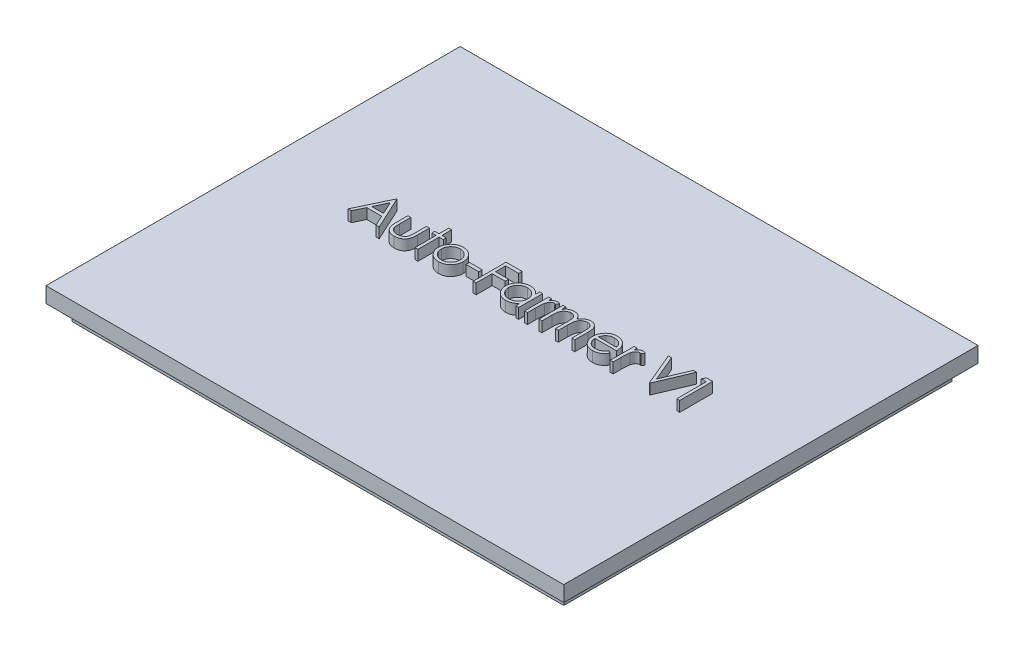
from build123d import *

# Parameters (mm, degrees)
SKETCH1_W           = 100
SKETCH1_H           = 80
BOSS_EXTRUDE1_DEPTH = 3
SKETCH2_W           = 95
SKETCH2_H           = 75
BOSS_EXTRUDE2_DEPTH = 3
SKETCH3_W           = 2.442307692
SKETCH3_H           = 0.651282051
BOSS_EXTRUDE3_DEPTH = 2


with BuildPart() as part:
    # Sketch1 → Boss-Extrude1 (new body)
    with BuildSketch(Plane(origin=(0, 0, 0), x_dir=(1, 0, 0), z_dir=(0, 1, 0))):
        Rectangle(SKETCH1_W, SKETCH1_H)
    extrude(amount=BOSS_EXTRUDE1_DEPTH)

    # Sketch2 → Boss-Extrude2 (add)
    with BuildSketch(Plane.XZ):
        Rectangle(SKETCH2_W, SKETCH2_H)
    extrude(amount=BOSS_EXTRUDE2_DEPTH)

    # Sketch3 → Boss-Extrude3 (add)
    # profile 1 of 13: a face of its own
    with BuildSketch(Plane(origin=(0, 3, 0), x_dir=(1, 0, 0), z_dir=(0, 1, 0))):
        Polygon((-28.580769231, 6.35), (-25.65, 0), (-26.26948117, 0), (-27.208243189, 2.03525641), (-30.086858974, 2.03525641), (-31.052333734, 0), (-31.674358974, 0), (-28.662179487, 6.35), align=None)
        Polygon((-28.627834535, 5.112309696), (-29.777754407, 2.686538462), (-27.50844351, 2.686538462), align=None, mode=Mode.SUBTRACT)
    # profile 2 of 13: a face of its own
    with BuildSketch(Plane(origin=(0, 3, 0), x_dir=(1, 0, 0), z_dir=(0, 1, 0))):
        with BuildLine():
            Line((-24.754487179, 4.640384615), (-24.184615385, 4.640384615))
            Line((-24.184615385, 4.640384615), (-24.184615385, 2.488100962))
            add(Edge.make_bspline(
                [(-24.184615385, 2.488100962), (-24.184357929, 2.424922545), (-24.183865427, 2.304065194), (-24.180525434, 2.130156498), (-24.172669407, 1.971557605), (-24.162847183, 1.828176897), (-24.150215879, 1.700038629), (-24.135187496, 1.587590367), (-24.118390074, 1.489556919), (-24.101947722, 1.430513974), (-24.094300881, 1.403054888)],
                knots=[0, 0, 0, 0, 1.388932606, 2.656963016, 3.823490214, 4.879454478, 5.816252168, 6.653371382, 7.373723809, 8, 8, 8, 8], degree=3))
            add(Edge.make_bspline(
                [(-24.094300881, 1.403054888), (-24.08203367, 1.368541965), (-24.05775428, 1.300233634), (-24.013715245, 1.201556439), (-23.959235263, 1.110161284), (-23.899618147, 1.022523894), (-23.830857793, 0.94124029), (-23.753824181, 0.866447733), (-23.671095951, 0.795320311), (-23.54816898, 0.711165045), (-23.380058598, 0.620967232), (-23.159345742, 0.543141961), (-22.920033789, 0.496631259), (-22.754634941, 0.491235111), (-22.669621394, 0.488461538)],
                knots=[0, 0, 0, 0, 0.725840625, 1.436591201, 2.137033971, 2.831655856, 3.53531722, 4.242432219, 4.957935707, 5.694543706, 7.190802206, 8.724350549, 10.316345118, 12, 12, 12, 12], degree=3))
            add(Edge.make_bspline(
                [(-22.669621394, 0.488461538), (-22.584615745, 0.491294089), (-22.420145541, 0.496774552), (-22.183462953, 0.541738972), (-21.967106816, 0.616860722), (-21.773248661, 0.721739883), (-21.60276778, 0.850086197), (-21.460701192, 1.000687893), (-21.343485173, 1.168780352), (-21.292305224, 1.294191544), (-21.266566506, 1.357261619)],
                knots=[0, 0, 0, 0, 1.157059328, 2.238695713, 3.266970494, 4.264342957, 5.228770407, 6.160125903, 7.074715775, 8, 8, 8, 8], degree=3))
            add(Edge.make_bspline(
                [(-21.266566506, 1.357261619), (-21.258956975, 1.382600475), (-21.242134159, 1.438618497), (-21.224059607, 1.533650326), (-21.207777369, 1.646978966), (-21.193874178, 1.779346002), (-21.183958812, 1.930405521), (-21.178613878, 2.100110317), (-21.172575435, 2.287927642), (-21.172483785, 2.419404862), (-21.172435897, 2.488100962)],
                knots=[0, 0, 0, 0, 0.557542046, 1.232589297, 2.036731608, 2.971723315, 4.038036528, 5.22795436, 6.551621927, 8, 8, 8, 8], degree=3))
            Line((-21.172435897, 2.488100962), (-21.172435897, 4.640384615))
            Line((-21.172435897, 4.640384615), (-20.602564103, 4.640384615))
            Line((-20.602564103, 4.640384615), (-20.602564103, 2.38125))
            add(Edge.make_bspline(
                [(-20.602564103, 2.38125), (-20.603365463, 2.304492703), (-20.604920212, 2.155573048), (-20.614912107, 1.939157588), (-20.632056404, 1.737477515), (-20.658078133, 1.550426074), (-20.688677285, 1.378146071), (-20.72814938, 1.220416705), (-20.775281326, 1.077723943), (-20.828449903, 0.947563862), (-20.891263863, 0.829550211), (-20.9580786, 0.717543801), (-21.035230686, 0.614323761), (-21.116456683, 0.514751884), (-21.206811115, 0.423780827), (-21.304600859, 0.339323149), (-21.408449521, 0.260087792), (-21.520661638, 0.189165042), (-21.639599066, 0.125271985), (-21.765408635, 0.068637101), (-21.899631303, 0.023819568), (-22.04053533, -0.014844068), (-22.188811059, -0.045168891), (-22.344315543, -0.066553091), (-22.506996404, -0.079661905), (-22.617866424, -0.080817687), (-22.674709535, -0.081410256)],
                knots=[0, 0, 0, 0, 1.493040784, 2.896703357, 4.213163133, 5.428574705, 6.569057535, 7.615249723, 8.588095153, 9.490268104, 10.346124644, 11.18633936, 12.024365274, 12.850166724, 13.684164916, 14.514361689, 15.362232829, 16.222528818, 17.093394965, 17.986930858, 18.902426812, 19.842810585, 20.827885679, 21.843828298, 22.894529745, 24, 24, 24, 24], degree=3))
            add(Edge.make_bspline(
                [(-22.674709535, -0.081410256), (-22.731127497, -0.080793931), (-22.841994043, -0.079582793), (-23.0046833, -0.066625513), (-23.160618629, -0.045202118), (-23.309245637, -0.014621938), (-23.450713472, 0.023548946), (-23.585595165, 0.068912503), (-23.712311343, 0.125301377), (-23.832384408, 0.18876066), (-23.944874455, 0.260543374), (-24.050300018, 0.339225389), (-24.148519736, 0.424689246), (-24.239555274, 0.516578023), (-24.322128817, 0.616031607), (-24.39726935, 0.722249981), (-24.466133658, 0.834180685), (-24.528459435, 0.954038136), (-24.582002191, 1.085704497), (-24.629273852, 1.231386373), (-24.667937438, 1.392680939), (-24.699401631, 1.569450295), (-24.72471353, 1.760848442), (-24.74228696, 1.967982567), (-24.752112824, 2.190348123), (-24.753678664, 2.343927209), (-24.754487179, 2.423227163)],
                knots=[0, 0, 0, 0, 1.083640291, 2.129454052, 3.13281866, 4.105697902, 5.042300162, 5.946461698, 6.836384745, 7.703652036, 8.553297018, 9.397182691, 10.228592656, 11.052265423, 11.879314572, 12.708807002, 13.549817954, 14.402308542, 15.300838682, 16.27712199, 17.341985831, 18.484375296, 19.725102775, 21.0496083, 22.476576903, 24, 24, 24, 24], degree=3))
            Line((-24.754487179, 2.423227163), (-24.754487179, 4.640384615))
        make_face()
    # profile 3 of 13: a face of its own
    with BuildSketch(Plane(origin=(0, 3, 0), x_dir=(1, 0, 0), z_dir=(0, 1, 0))):
        Polygon((-18.730128205, 6.512820513), (-18.16025641, 6.512820513), (-18.16025641, 4.640384615), (-17.346153846, 4.640384615), (-17.346153846, 4.070512821), (-18.16025641, 4.070512821), (-18.16025641, 0), (-18.730128205, 0), (-18.730128205, 4.070512821), (-19.544230769, 4.070512821), (-19.544230769, 4.640384615), (-18.730128205, 4.640384615), align=None)
    # profile 4 of 13: a face of its own
    with BuildSketch(Plane(origin=(0, 3, 0), x_dir=(1, 0, 0), z_dir=(0, 1, 0))):
        with BuildLine():
            add(Edge.make_bspline(
                [(-14.127904647, 4.721794872), (-14.040834767, 4.719940869), (-13.870112009, 4.716305624), (-13.620089131, 4.677452757), (-13.38142867, 4.618039682), (-13.153216578, 4.535904134), (-12.938375585, 4.425809738), (-12.733776328, 4.294438595), (-12.539979755, 4.138804461), (-12.423823687, 4.018411966), (-12.364863782, 3.957301683)],
                knots=[0, 0, 0, 0, 1.054011418, 2.066658804, 3.057071809, 4.030435133, 4.997543892, 5.974964718, 6.972108034, 8, 8, 8, 8], degree=3))
            add(Edge.make_bspline(
                [(-12.364863782, 3.957301683), (-12.314096523, 3.898856308), (-12.21354449, 3.783096639), (-12.084610971, 3.595398598), (-11.973537569, 3.401015844), (-11.88452334, 3.197367123), (-11.814337654, 2.98623022), (-11.764507034, 2.766879428), (-11.734867166, 2.53979917), (-11.730870355, 2.385577921), (-11.728846154, 2.307471955)],
                knots=[0, 0, 0, 0, 1.025258237, 2.030674902, 3.01204498, 3.988269485, 4.97094183, 5.956517959, 6.965070386, 8, 8, 8, 8], degree=3))
            add(Edge.make_bspline(
                [(-11.728846154, 2.307471955), (-11.73062658, 2.228913279), (-11.734144785, 2.073677671), (-11.767425347, 1.845042536), (-11.819188888, 1.623346215), (-11.893269509, 1.409516871), (-11.988262079, 1.202900884), (-12.10417804, 1.004400702), (-12.241830831, 0.813624688), (-12.397866654, 0.632192782), (-12.570317915, 0.464976935), (-12.75740007, 0.319238503), (-12.955436674, 0.194376595), (-13.167061043, 0.093799098), (-13.390340627, 0.014497213), (-13.625757022, -0.041201388), (-13.872944506, -0.074877586), (-14.041722465, -0.079202069), (-14.127904647, -0.081410256)],
                knots=[0, 0, 0, 0, 0.998656419, 1.973391657, 2.932242238, 3.890759089, 4.846373663, 5.82037756, 6.809684879, 7.83454468, 8.860553229, 9.859544525, 10.845671541, 11.83227036, 12.833544569, 13.85385346, 14.904124723, 16, 16, 16, 16], degree=3))
            add(Edge.make_bspline(
                [(-14.127904647, -0.081410256), (-14.214509067, -0.079194658), (-14.384128198, -0.074855295), (-14.632188194, -0.041332225), (-14.868026503, 0.014471543), (-15.091598389, 0.094059709), (-15.304132611, 0.194379809), (-15.503316684, 0.318861018), (-15.690550816, 0.465020156), (-15.86303856, 0.632181071), (-16.019064601, 0.813627706), (-16.156719916, 1.004399919), (-16.272635222, 1.202901088), (-16.367627963, 1.409516816), (-16.441708538, 1.62334623), (-16.493472092, 1.845042532), (-16.52675265, 2.073677672), (-16.530270856, 2.228913279), (-16.532051282, 2.307471955)],
                knots=[0, 0, 0, 0, 1.099876186, 2.154163076, 3.173186993, 4.173200201, 5.163417411, 6.152872554, 7.150605724, 8.17532212, 9.198891216, 10.186952605, 11.159729845, 12.11414092, 13.071450619, 14.029093627, 15.002601286, 16, 16, 16, 16], degree=3))
            add(Edge.make_bspline(
                [(-16.532051282, 2.307471955), (-16.530013276, 2.385153403), (-16.525978375, 2.538949318), (-16.496368308, 2.7656027), (-16.44673207, 2.984582249), (-16.376462251, 3.194904184), (-16.286627547, 3.397660475), (-16.177114925, 3.592523525), (-16.046866206, 3.77937282), (-15.946714094, 3.89498288), (-15.896033654, 3.953485577)],
                knots=[0, 0, 0, 0, 1.031353054, 2.041901799, 3.029428768, 4.008703097, 4.981709435, 5.96992636, 6.972712378, 8, 8, 8, 8], degree=3))
            add(Edge.make_bspline(
                [(-15.896033654, 3.953485577), (-15.837162639, 4.015125824), (-15.721382429, 4.136352216), (-15.526621165, 4.291532652), (-15.322525233, 4.425637529), (-15.10531001, 4.533544377), (-14.877285396, 4.618522831), (-14.637401913, 4.677605979), (-14.386530621, 4.716165638), (-14.214972451, 4.71989976), (-14.127904647, 4.721794872)],
                knots=[0, 0, 0, 0, 1.027980169, 2.021703884, 2.998553061, 3.971491411, 4.943284454, 5.930300938, 6.949603206, 8, 8, 8, 8], degree=3))
        make_face()
        with BuildLine():
            add(Edge.make_bspline(
                [(-14.130448718, 4.151923077), (-14.192021241, 4.150173032), (-14.313576803, 4.146718119), (-14.492500907, 4.120440178), (-14.664749472, 4.078806849), (-14.830649289, 4.019653776), (-14.989640902, 3.943274345), (-15.141876532, 3.849460606), (-15.287803959, 3.739455099), (-15.424568559, 3.613429966), (-15.55008504, 3.47576379), (-15.659809369, 3.329081768), (-15.753109205, 3.175763111), (-15.830833493, 3.015648385), (-15.888722249, 2.847115005), (-15.930764732, 2.672071574), (-15.957017883, 2.490161462), (-15.960440313, 2.3664979), (-15.962179487, 2.303655849)],
                knots=[0, 0, 0, 0, 1.021534396, 2.016698045, 2.994645724, 3.958388632, 4.93408049, 5.916473867, 6.921342795, 7.962252576, 8.998418191, 10.008913653, 10.997312074, 11.973003931, 12.956656626, 13.948281152, 14.957379055, 16, 16, 16, 16], degree=3))
            add(Edge.make_bspline(
                [(-15.962179487, 2.303655849), (-15.95926425, 2.222462886), (-15.953478049, 2.061310036), (-15.90642412, 1.823981285), (-15.827709013, 1.596139924), (-15.721414948, 1.379121624), (-15.588235094, 1.178330491), (-15.431322845, 0.999312227), (-15.252362245, 0.844760826), (-15.053486595, 0.716525577), (-14.838758047, 0.614635735), (-14.611507293, 0.542429022), (-14.374487748, 0.49549038), (-14.212506993, 0.490824991), (-14.130448718, 0.488461538)],
                knots=[0, 0, 0, 0, 1.016792936, 2.018143844, 3.017858371, 4.030088057, 5.03801393, 6.028138512, 7.003788237, 7.991172063, 8.984598303, 9.972568034, 10.972917682, 12, 12, 12, 12], degree=3))
            add(Edge.make_bspline(
                [(-14.130448718, 0.488461538), (-14.048395163, 0.490838761), (-13.886423724, 0.495531333), (-13.649733504, 0.54219262), (-13.423103869, 0.614952119), (-13.208598352, 0.716410985), (-13.009813228, 0.845247795), (-12.829565537, 0.998439508), (-12.673993056, 1.178804638), (-12.540944945, 1.379387583), (-12.43291014, 1.595803479), (-12.354563474, 1.824023336), (-12.307396425, 2.061299326), (-12.301625493, 2.222459298), (-12.298717949, 2.303655849)],
                knots=[0, 0, 0, 0, 1.02726834, 2.027799167, 3.010890988, 4.004497153, 4.992059811, 5.971914811, 6.958719428, 7.966827853, 8.981595046, 9.981490638, 10.983022906, 12, 12, 12, 12], degree=3))
            add(Edge.make_bspline(
                [(-12.298717949, 2.303655849), (-12.300456524, 2.366498275), (-12.303877776, 2.490162576), (-12.330139497, 2.672067314), (-12.372150262, 2.847130639), (-12.43015591, 3.015590702), (-12.507542478, 3.176177674), (-12.602641517, 3.328631607), (-12.711917806, 3.476271912), (-12.838948868, 3.612984946), (-12.975570711, 3.739504227), (-13.12155728, 3.849503262), (-13.27356717, 3.942862043), (-13.432096884, 4.020307079), (-13.598017971, 4.078268682), (-13.770025191, 4.120680571), (-13.948185889, 4.14660707), (-14.069305868, 4.150139741), (-14.130448718, 4.151923077)],
                knots=[0, 0, 0, 0, 1.042956736, 2.052379634, 3.044323526, 4.02829302, 5.004299113, 5.996692471, 7.007513377, 8.048758398, 9.090003419, 10.095195979, 11.07790575, 12.047570684, 13.018257071, 13.989683339, 14.985167495, 16, 16, 16, 16], degree=3))
        make_face(mode=Mode.SUBTRACT)
    # profile 5 of 13: a face of its own
    with BuildSketch(Plane(origin=(0, 3, 0), x_dir=(1, 0, 0), z_dir=(0, 1, 0))):
        with Locations((-9.775, 2.442307693)):
            Rectangle(SKETCH3_W, SKETCH3_H)
    # profile 6 of 13: a face of its own
    with BuildSketch(Plane(origin=(0, 3, 0), x_dir=(1, 0, 0), z_dir=(0, 1, 0))):
        Polygon((-7.495512821, 6.35), (-4.401923077, 6.35), (-4.401923077, 5.698717949), (-6.925641026, 5.698717949), (-6.925641026, 3.744871795), (-4.401923077, 3.744871795), (-4.401923077, 3.093589744), (-6.925641026, 3.093589744), (-6.925641026, 0), (-7.495512821, 0), align=None)
    # profile 7 of 13: a face of its own
    with BuildSketch(Plane(origin=(0, 3, 0), x_dir=(1, 0, 0), z_dir=(0, 1, 0))):
        with BuildLine():
            Line((1.296794872, 4.640384615), (1.296794872, 0))
            Line((1.296794872, 0), (0.726923077, 0))
            Line((0.726923077, 0), (0.726923077, 0.802654247))
            add(Edge.make_bspline(
                [(0.726923077, 0.802654247), (0.662663271, 0.730010983), (0.537259452, 0.588246742), (0.327816281, 0.403040514), (0.105805444, 0.249954131), (-0.127695525, 0.126310713), (-0.372475766, 0.033433696), (-0.627992667, -0.032581193), (-0.894350458, -0.075024294), (-1.076236873, -0.079262505), (-1.168409455, -0.081410256)],
                knots=[0, 0, 0, 0, 1.074387032, 2.096679803, 3.090159297, 4.057316773, 5.018401886, 5.985159533, 6.978961417, 8, 8, 8, 8], degree=3))
            add(Edge.make_bspline(
                [(-1.168409455, -0.081410256), (-1.250357029, -0.079185267), (-1.411961272, -0.074797489), (-1.649685454, -0.040757309), (-1.878452821, 0.013908247), (-2.098479546, 0.089928433), (-2.308341867, 0.190767923), (-2.509836614, 0.311492759), (-2.701919927, 0.455258265), (-2.881664004, 0.619610831), (-3.047184919, 0.79812745), (-3.192438942, 0.988528657), (-3.313548102, 1.189991122), (-3.414821677, 1.39996413), (-3.49282933, 1.620064056), (-3.547210067, 1.849529775), (-3.581210591, 2.088089974), (-3.585596556, 2.250540251), (-3.587820513, 2.33291266)],
                knots=[0, 0, 0, 0, 1.033919861, 2.038935746, 3.024066025, 3.998881131, 4.97069526, 5.957263378, 6.95902576, 7.993208707, 9.027059324, 10.027763471, 11.009749337, 11.988697705, 12.965288445, 13.950418724, 14.960734635, 16, 16, 16, 16], degree=3))
            add(Edge.make_bspline(
                [(-3.587820513, 2.33291266), (-3.585547265, 2.413582522), (-3.581053176, 2.573062488), (-3.547573763, 2.807610983), (-3.491274647, 3.033522685), (-3.412266409, 3.250070282), (-3.310953148, 3.457515801), (-3.18771219, 3.656005961), (-3.042534635, 3.846087582), (-2.875162411, 4.023291094), (-2.693852185, 4.186977065), (-2.499889202, 4.329233476), (-2.298098392, 4.452091188), (-2.085349787, 4.549433923), (-1.864792325, 4.628190441), (-1.634462502, 4.682678826), (-1.395318638, 4.714786824), (-1.232957317, 4.71943641), (-1.150600962, 4.721794872)],
                knots=[0, 0, 0, 0, 1.020392517, 2.01726096, 2.990465484, 3.961182959, 4.928053699, 5.906110375, 6.912531644, 7.948652711, 8.985773172, 9.998621852, 10.987621588, 11.969261332, 12.953316658, 13.946091881, 14.958173133, 16, 16, 16, 16], degree=3))
            add(Edge.make_bspline(
                [(-1.150600962, 4.721794872), (-1.055895503, 4.71918638), (-0.870182568, 4.71407125), (-0.59853318, 4.671503159), (-0.341549627, 4.599587654), (-0.09724816, 4.501765908), (0.133493942, 4.371774642), (0.348492213, 4.20779957), (0.549996733, 4.010874845), (0.666800976, 3.859617039), (0.726923077, 3.781760817)],
                knots=[0, 0, 0, 0, 1.038897134, 2.037228247, 3.008116434, 3.962042015, 4.918381754, 5.904844433, 6.921570401, 8, 8, 8, 8], degree=3))
            Line((0.726923077, 3.781760817), (0.726923077, 4.640384615))
            Line((0.726923077, 4.640384615), (1.296794872, 4.640384615))
        make_face()
        with BuildLine():
            add(Edge.make_bspline(
                [(-1.14296875, 4.151923077), (-1.226270477, 4.148959191), (-1.390694837, 4.143108953), (-1.63207467, 4.09743704), (-1.863057578, 4.021446419), (-2.082488313, 3.917520684), (-2.286900649, 3.786839976), (-2.469587737, 3.628776895), (-2.632043781, 3.447644026), (-2.768674489, 3.244258769), (-2.88005439, 3.026221375), (-2.95837172, 2.798302752), (-3.010023069, 2.564613721), (-3.015299956, 2.406112848), (-3.017948718, 2.326552484)],
                knots=[0, 0, 0, 0, 1.031046209, 2.035121221, 3.029706178, 4.034933723, 5.034054252, 6.02443088, 7.017295772, 8.038157696, 9.050218397, 10.03989886, 11.016116709, 12, 12, 12, 12], degree=3))
            add(Edge.make_bspline(
                [(-3.017948718, 2.326552484), (-3.014565269, 2.247467575), (-3.007811632, 2.089607744), (-2.959278229, 1.855600126), (-2.877853316, 1.627627793), (-2.766742717, 1.407625704), (-2.627611269, 1.203365979), (-2.466341856, 1.018780328), (-2.281374917, 0.860049218), (-2.076492155, 0.727175335), (-1.857674837, 0.619837618), (-1.627561847, 0.545151387), (-1.390478903, 0.496931699), (-1.229275383, 0.491299291), (-1.148056891, 0.488461538)],
                knots=[0, 0, 0, 0, 0.979072187, 1.954306742, 2.945804271, 3.96968567, 4.997920485, 5.998718438, 6.996577872, 8.005894225, 9.015743152, 10.005417472, 10.995077863, 12, 12, 12, 12], degree=3))
            add(Edge.make_bspline(
                [(-1.148056891, 0.488461538), (-1.06560395, 0.491473187), (-0.901613229, 0.497463058), (-0.659517288, 0.543330497), (-0.424576427, 0.619111031), (-0.199991026, 0.724156589), (0.009225383, 0.854344935), (0.197000104, 1.0067578), (0.355779075, 1.184019291), (0.490385667, 1.378830856), (0.595932494, 1.59239405), (0.672814773, 1.819786081), (0.718269716, 2.061014867), (0.72399874, 2.225867992), (0.726923077, 2.310016026)],
                knots=[0, 0, 0, 0, 1.01762866, 2.023962475, 3.030623092, 4.058876274, 5.077231937, 6.066672613, 7.034107872, 8.005628644, 8.981990164, 9.965428785, 10.961468474, 12, 12, 12, 12], degree=3))
            add(Edge.make_bspline(
                [(0.726923077, 2.310016026), (0.725181986, 2.374128947), (0.721754968, 2.500323464), (0.695573792, 2.685611961), (0.653926997, 2.862928863), (0.595241803, 3.032460599), (0.518150473, 3.193269842), (0.425172383, 3.346511235), (0.314672496, 3.491387776), (0.188429604, 3.62590449), (0.050244165, 3.748598215), (-0.095977358, 3.858116194), (-0.251967371, 3.948084396), (-0.415102566, 4.022544989), (-0.585665987, 4.081798018), (-0.76504554, 4.121327119), (-0.95133456, 4.148469416), (-1.078418117, 4.150759736), (-1.14296875, 4.151923077)],
                knots=[0, 0, 0, 0, 1.050140795, 2.067009409, 3.05949893, 4.030605086, 5.00011959, 5.97591094, 6.962425594, 7.979863591, 8.993523472, 9.986985069, 10.967611495, 11.937549037, 12.921786183, 13.919465291, 14.943216303, 16, 16, 16, 16], degree=3))
        make_face(mode=Mode.SUBTRACT)
    # profile 8 of 13: a face of its own
    with BuildSketch(Plane(origin=(0, 3, 0), x_dir=(1, 0, 0), z_dir=(0, 1, 0))):
        with BuildLine():
            Line((2.436538462, 4.640384615), (3.006410256, 4.640384615))
            Line((3.006410256, 4.640384615), (3.006410256, 3.957301683))
            add(Edge.make_bspline(
                [(3.006410256, 3.957301683), (3.04848129, 4.020902971), (3.128941815, 4.142539941), (3.26267813, 4.303411387), (3.399662745, 4.436607258), (3.540551442, 4.542749356), (3.686380281, 4.622238872), (3.83394875, 4.680464807), (3.985578531, 4.714895079), (4.087472308, 4.71949186), (4.138521635, 4.721794872)],
                knots=[0, 0, 0, 0, 1.2804753, 2.448899062, 3.506932113, 4.484331642, 5.4025378, 6.288909075, 7.142734305, 8, 8, 8, 8], degree=3))
            add(Edge.make_bspline(
                [(4.138521635, 4.721794872), (4.178120827, 4.719634916), (4.259598739, 4.715190668), (4.38293858, 4.683965315), (4.510017414, 4.634112331), (4.591918603, 4.587230784), (4.634615385, 4.562790465)],
                knots=[0, 0, 0, 0, 0.901110191, 1.854092781, 2.881294221, 4, 4, 4, 4], degree=3))
            Line((4.634615385, 4.562790465), (4.321694712, 4.069240785))
            add(Edge.make_bspline(
                [(4.321694712, 4.069240785), (4.29428263, 4.081469554), (4.242249253, 4.104682097), (4.166131682, 4.13215403), (4.095952686, 4.148330049), (4.05124223, 4.150780636), (4.030398638, 4.151923077)],
                knots=[0, 0, 0, 0, 1.180555205, 2.24091978, 3.179933427, 4, 4, 4, 4], degree=3))
            add(Edge.make_bspline(
                [(4.030398638, 4.151923077), (3.984668236, 4.148875009), (3.891391471, 4.142657834), (3.754441022, 4.09378314), (3.621549663, 4.014815919), (3.516009648, 3.92723833), (3.434290132, 3.842787326), (3.37597858, 3.76903951), (3.322488453, 3.68634685), (3.271379624, 3.596122995), (3.224813634, 3.496827417), (3.181353019, 3.389452159), (3.142057654, 3.273872854), (3.119650782, 3.193350281), (3.108173077, 3.152103365)],
                knots=[0, 0, 0, 0, 1.125678352, 2.296057538, 3.5422874, 4.923748041, 5.663163013, 6.437101912, 7.23742474, 8.08941207, 8.991984279, 9.93940061, 10.944477711, 12, 12, 12, 12], degree=3))
            add(Edge.make_bspline(
                [(3.108173077, 3.152103365), (3.099587163, 3.115314779), (3.080570017, 3.033830856), (3.062079655, 2.897127104), (3.043810673, 2.735612751), (3.030935379, 2.548838219), (3.019000932, 2.337269928), (3.012269782, 2.100585569), (3.006639799, 1.838542203), (3.006489092, 1.655345877), (3.006410256, 1.559515224)],
                knots=[0, 0, 0, 0, 0.566838948, 1.255505196, 2.06880316, 3.007127437, 4.065329342, 5.249902469, 6.561414163, 8, 8, 8, 8], degree=3))
            Line((3.006410256, 1.559515224), (3.006410256, 0))
            Line((3.006410256, 0), (2.436538462, 0))
            Line((2.436538462, 0), (2.436538462, 4.640384615))
        make_face()
    # profile 9 of 13: a face of its own
    with BuildSketch(Plane(origin=(0, 3, 0), x_dir=(1, 0, 0), z_dir=(0, 1, 0))):
        with BuildLine():
            Line((5.204487179, 4.640384615), (5.774358974, 4.640384615))
            Line((5.774358974, 4.640384615), (5.774358974, 3.833914263))
            add(Edge.make_bspline(
                [(5.774358974, 3.833914263), (5.825674141, 3.904467483), (5.923998919, 4.039654217), (6.085226603, 4.217799447), (6.246291835, 4.368980528), (6.362285256, 4.448342595), (6.418008814, 4.486468349)],
                knots=[0, 0, 0, 0, 1.134379233, 2.173579362, 3.122582517, 4, 4, 4, 4], degree=3))
            add(Edge.make_bspline(
                [(6.418008814, 4.486468349), (6.493963273, 4.522763798), (6.644545176, 4.594720571), (6.882977199, 4.667715742), (7.126952671, 4.71257414), (7.291704716, 4.718708917), (7.374579327, 4.721794872)],
                knots=[0, 0, 0, 0, 1.014936303, 2.012140481, 3.000054389, 4, 4, 4, 4], degree=3))
            add(Edge.make_bspline(
                [(7.374579327, 4.721794872), (7.430628049, 4.719898416), (7.541545457, 4.716145431), (7.705890878, 4.691725081), (7.865291502, 4.649513596), (8.018805527, 4.590717451), (8.163441616, 4.519512748), (8.296046303, 4.435965421), (8.415107367, 4.342172155), (8.520564631, 4.23389752), (8.615395577, 4.108101119), (8.702624342, 3.961390268), (8.78322437, 3.790470654), (8.827894459, 3.666434216), (8.85141226, 3.601131811)],
                knots=[0, 0, 0, 0, 1.009824226, 1.998387844, 2.986035974, 3.974953746, 4.955485308, 5.885931332, 6.793869504, 7.679848016, 8.601185859, 9.625726857, 10.749998409, 12, 12, 12, 12], degree=3))
            add(Edge.make_bspline(
                [(8.85141226, 3.601131811), (8.876288387, 3.645988972), (8.925241112, 3.734261564), (9.007438483, 3.859190126), (9.093558628, 3.976042448), (9.184335494, 4.084911247), (9.279448673, 4.1852589), (9.379345785, 4.277417179), (9.483458174, 4.361781852), (9.628224095, 4.460339585), (9.816569825, 4.565026014), (10.054038262, 4.655791905), (10.301053573, 4.711882595), (10.468725683, 4.718468947), (10.553395433, 4.721794872)],
                knots=[0, 0, 0, 0, 0.86119277, 1.694706429, 2.50939023, 3.298075842, 4.073795165, 4.829715201, 5.57930267, 6.321991688, 7.768977793, 9.186738141, 10.579381044, 12, 12, 12, 12], degree=3))
            add(Edge.make_bspline(
                [(10.553395433, 4.721794872), (10.631194658, 4.718860771), (10.783455296, 4.713118451), (11.005119764, 4.66802715), (11.211842753, 4.590597704), (11.403208306, 4.484945249), (11.575855396, 4.352177302), (11.725926414, 4.194209554), (11.852509787, 4.012159367), (11.935202462, 3.84090533), (11.991291585, 3.689711226), (12.02587411, 3.560885526), (12.056426128, 3.41909628), (12.081792102, 3.264173948), (12.100331475, 3.095571273), (12.114066916, 2.91356417), (12.123363449, 2.718011182), (12.124020352, 2.583090917), (12.124358974, 2.513541667)],
                knots=[0, 0, 0, 0, 1.209669288, 2.367440248, 3.500751976, 4.631527125, 5.755587489, 6.87532382, 8.007944318, 9.190864318, 9.82315674, 10.514484317, 11.263564316, 12.079023757, 12.955305781, 13.901327259, 14.918167583, 16, 16, 16, 16], degree=3))
            Line((12.124358974, 2.513541667), (12.124358974, 0))
            Line((12.124358974, 0), (11.554487179, 0))
            Line((11.554487179, 0), (11.554487179, 2.516085737))
            add(Edge.make_bspline(
                [(11.554487179, 2.516085737), (11.554345878, 2.575450207), (11.554074317, 2.68953969), (11.549187299, 2.853283423), (11.53997923, 3.002541728), (11.529212099, 3.137111088), (11.514255474, 3.257305318), (11.494940712, 3.362882992), (11.474479778, 3.454674621), (11.440487337, 3.556430736), (11.386153305, 3.668680975), (11.303390163, 3.789736606), (11.19912297, 3.895111772), (11.078726686, 3.986585004), (10.941660222, 4.060959181), (10.790594224, 4.114074227), (10.626466588, 4.146954307), (10.512850958, 4.150230935), (10.454176683, 4.151923077)],
                knots=[0, 0, 0, 0, 1.253487763, 2.409012846, 3.458416907, 4.410876679, 5.259312806, 6.014470957, 6.676830364, 7.243083969, 8.276244668, 9.299465089, 10.325150304, 11.392391894, 12.482080715, 13.603491619, 14.762376348, 16, 16, 16, 16], degree=3))
            add(Edge.make_bspline(
                [(10.454176683, 4.151923077), (10.382204051, 4.149353763), (10.239958769, 4.144275821), (10.032321959, 4.092434652), (9.832803114, 4.014274768), (9.647355659, 3.901004453), (9.476762382, 3.765280708), (9.329987433, 3.603900727), (9.208734754, 3.421329288), (9.126631112, 3.252334556), (9.074761951, 3.10053428), (9.040513832, 2.967914762), (9.013873965, 2.81718106), (8.98889029, 2.649346041), (8.972583984, 2.463254428), (8.957764223, 2.259767044), (8.950832086, 2.03827186), (8.949862425, 1.884734868), (8.949358974, 1.805018029)],
                knots=[0, 0, 0, 0, 1.090531906, 2.155305635, 3.229839962, 4.33261226, 5.44038871, 6.529323825, 7.629011124, 8.757537029, 9.370236727, 10.061839251, 10.834451254, 11.692844982, 12.636905849, 13.66920014, 14.789842145, 16, 16, 16, 16], degree=3))
            Line((8.949358974, 1.805018029), (8.949358974, 0))
            Line((8.949358974, 0), (8.379487179, 0))
            Line((8.379487179, 0), (8.379487179, 2.359625401))
            add(Edge.make_bspline(
                [(8.379487179, 2.359625401), (8.379343069, 2.426197565), (8.379065815, 2.554275717), (8.374210211, 2.737942528), (8.364981626, 2.905003916), (8.354312631, 3.055265715), (8.33896345, 3.18845484), (8.321528596, 3.305285329), (8.300938974, 3.405464292), (8.266848754, 3.515343576), (8.214752505, 3.636394393), (8.130953801, 3.765464532), (8.026437191, 3.878436652), (7.903844316, 3.974881809), (7.765948293, 4.054604211), (7.613578408, 4.112044047), (7.448106638, 4.145470972), (7.334028514, 4.149731816), (7.275360577, 4.151923077)],
                knots=[0, 0, 0, 0, 1.320475261, 2.540461679, 3.643808994, 4.639130445, 5.527981419, 6.302341397, 6.981980563, 7.553956391, 8.582137848, 9.585246428, 10.591171744, 11.620968678, 12.668337649, 13.738356861, 14.836885341, 16, 16, 16, 16], degree=3))
            add(Edge.make_bspline(
                [(7.275360577, 4.151923077), (7.206388308, 4.149146385), (7.068929024, 4.143612537), (6.866995451, 4.09380264), (6.67198571, 4.015780962), (6.487010757, 3.907541004), (6.317059088, 3.773466962), (6.16827266, 3.615778508), (6.043191221, 3.436438119), (5.960220642, 3.269225353), (5.906701982, 3.121228126), (5.871150446, 2.995405692), (5.840598554, 2.855705242), (5.817894543, 2.701695769), (5.795977217, 2.534380355), (5.785399371, 2.352925495), (5.775109537, 2.15748685), (5.774615299, 2.022553804), (5.774358974, 1.952574119)],
                knots=[0, 0, 0, 0, 1.098833095, 2.189935336, 3.297829714, 4.440610912, 5.596351641, 6.740013378, 7.886572111, 9.072425424, 9.705826452, 10.395263256, 11.156850408, 11.985370555, 12.878090359, 13.847760091, 14.883794034, 16, 16, 16, 16], degree=3))
            Line((5.774358974, 1.952574119), (5.774358974, 0))
            Line((5.774358974, 0), (5.204487179, 0))
            Line((5.204487179, 0), (5.204487179, 4.640384615))
        make_face()
    # profile 10 of 13: a face of its own
    with BuildSketch(Plane(origin=(0, 3, 0), x_dir=(1, 0, 0), z_dir=(0, 1, 0))):
        with BuildLine():
            Line((17.235396635, 1.465384615), (17.741666667, 1.199529247))
            add(Edge.make_bspline(
                [(17.741666667, 1.199529247), (17.70132313, 1.127967774), (17.622830583, 0.988737488), (17.487846369, 0.79745397), (17.346346466, 0.625373114), (17.191943552, 0.477092169), (17.029257135, 0.3478218), (16.857385032, 0.234723175), (16.675432463, 0.138351002), (16.48339082, 0.05715713), (16.279647348, -0.005271524), (16.063708311, -0.049366324), (15.835160027, -0.076622826), (15.678503386, -0.07978901), (15.59828726, -0.081410256)],
                knots=[0, 0, 0, 0, 1.120438281, 2.179929193, 3.190490725, 4.156257408, 5.095198341, 6.022838206, 6.959905092, 7.901321166, 8.864066838, 9.862729781, 10.905609505, 12, 12, 12, 12], degree=3))
            add(Edge.make_bspline(
                [(15.59828726, -0.081410256), (15.509129672, -0.079328953), (15.335209047, -0.075268932), (15.082044077, -0.040266889), (14.843684275, 0.016832962), (14.620143042, 0.096599015), (14.411967812, 0.200788589), (14.218744833, 0.327715078), (14.039457979, 0.476726454), (13.879756914, 0.64911343), (13.735985869, 0.833593552), (13.609120453, 1.0258278), (13.503061971, 1.225332507), (13.41678795, 1.430837601), (13.347110552, 1.641047808), (13.298548104, 1.857875756), (13.270554132, 2.080734602), (13.266264352, 2.231496911), (13.264102564, 2.307471955)],
                knots=[0, 0, 0, 0, 1.145258523, 2.234067595, 3.276747158, 4.290159414, 5.277019952, 6.260822364, 7.254936242, 8.264827045, 9.274100331, 10.257902744, 11.220704747, 12.172965371, 13.118907548, 14.062713208, 15.023725156, 16, 16, 16, 16], degree=3))
            add(Edge.make_bspline(
                [(13.264102564, 2.307471955), (13.266024149, 2.378764005), (13.269832477, 2.520055432), (13.293836905, 2.729180063), (13.336378808, 2.932431684), (13.394755853, 3.129979182), (13.470141686, 3.321491797), (13.562365855, 3.507086084), (13.671572026, 3.686564552), (13.755886734, 3.799781666), (13.798357372, 3.856810897)],
                knots=[0, 0, 0, 0, 1.024358464, 2.0301432, 3.019427413, 4.004406732, 4.986367066, 5.972626655, 6.978780325, 8, 8, 8, 8], degree=3))
            add(Edge.make_bspline(
                [(13.798357372, 3.856810897), (13.855884168, 3.925515847), (13.969115457, 4.060749349), (14.160624844, 4.238437454), (14.367998057, 4.387288304), (14.588636293, 4.510672679), (14.825103896, 4.604423439), (15.074222182, 4.674287195), (15.338827745, 4.713435872), (15.519721503, 4.718965513), (15.612279647, 4.721794872)],
                knots=[0, 0, 0, 0, 1.030682036, 2.02871468, 2.997146059, 3.962720338, 4.930598197, 5.918074684, 6.934738563, 8, 8, 8, 8], degree=3))
            add(Edge.make_bspline(
                [(15.612279647, 4.721794872), (15.707434588, 4.71933824), (15.894106892, 4.714518889), (16.166308026, 4.669839684), (16.423865326, 4.598987192), (16.666675726, 4.498922458), (16.894763845, 4.3698187), (17.106647107, 4.209904216), (17.305949136, 4.024088544), (17.421897558, 3.881189578), (17.480899439, 3.808473558)],
                knots=[0, 0, 0, 0, 1.056321875, 2.072262726, 3.055038591, 4.01806755, 4.982017516, 5.957941055, 6.960871419, 8, 8, 8, 8], degree=3))
            add(Edge.make_bspline(
                [(17.480899439, 3.808473558), (17.521044027, 3.753675631), (17.601065989, 3.64444453), (17.701300013, 3.466334003), (17.78830843, 3.279987638), (17.857855373, 3.082393242), (17.914169897, 2.875892004), (17.954912982, 2.659007673), (17.978806433, 2.431804834), (17.98350307, 2.276998083), (17.985897436, 2.198076923)],
                knots=[0, 0, 0, 0, 0.94817472, 1.890038105, 2.849395472, 3.817997239, 4.812318967, 5.836947057, 6.897266129, 8, 8, 8, 8], degree=3))
            Line((17.985897436, 2.198076923), (13.833974359, 2.198076923))
            add(Edge.make_bspline(
                [(13.833974359, 2.198076923), (13.836767645, 2.136934652), (13.842260529, 2.016700843), (13.867869432, 1.840768136), (13.908235064, 1.673176501), (13.964966078, 1.515182982), (14.033667354, 1.364724036), (14.117824297, 1.222915769), (14.21822606, 1.090404096), (14.330214114, 0.966003718), (14.454868416, 0.855222051), (14.586009971, 0.756068114), (14.725516868, 0.672963675), (14.872289105, 0.605508732), (15.026089344, 0.552701558), (15.186966041, 0.516655655), (15.354602623, 0.492512761), (15.468876741, 0.489828226), (15.527053285, 0.488461538)],
                knots=[0, 0, 0, 0, 1.094153842, 2.151609401, 3.174256925, 4.172055639, 5.149267565, 6.128595816, 7.11444997, 8.118368179, 9.117203808, 10.09244225, 11.054858984, 12.015122123, 12.976791628, 13.957293641, 14.960065497, 16, 16, 16, 16], degree=3))
            add(Edge.make_bspline(
                [(15.527053285, 0.488461538), (15.583933224, 0.489564727), (15.696793935, 0.491753665), (15.864870919, 0.513038703), (16.030224062, 0.547456203), (16.192168989, 0.594428042), (16.347418952, 0.651717474), (16.491193021, 0.720846944), (16.623418555, 0.797318628), (16.747002195, 0.884784752), (16.866873854, 0.991842463), (16.985786651, 1.1254387), (17.113288579, 1.283440357), (17.193098269, 1.402358923), (17.235396635, 1.465384615)],
                knots=[0, 0, 0, 0, 0.99110716, 1.966546729, 2.947904876, 3.932708344, 4.903319531, 5.828989031, 6.710028674, 7.56322171, 8.463672341, 9.504779593, 10.677557249, 12, 12, 12, 12], degree=3))
        make_face()
        with BuildLine():
            add(Edge.make_bspline(
                [(17.416025641, 2.767948718), (17.395167479, 2.843537075), (17.355022232, 2.989020329), (17.271136257, 3.19048023), (17.176663604, 3.369528279), (17.064864178, 3.524794185), (16.938193061, 3.662686273), (16.791879658, 3.783188563), (16.627803109, 3.890988796), (16.446811525, 3.981979759), (16.255147143, 4.05943136), (16.054475909, 4.111365498), (15.849719637, 4.146942811), (15.711227432, 4.150255893), (15.641536458, 4.151923077)],
                knots=[0, 0, 0, 0, 1.154881502, 2.222775134, 3.210006277, 4.132804581, 5.035138423, 5.962687519, 6.919655026, 7.923214229, 8.944639381, 9.960483929, 10.97369054, 12, 12, 12, 12], degree=3))
            add(Edge.make_bspline(
                [(15.641536458, 4.151923077), (15.58465962, 4.15081333), (15.472226068, 4.148619594), (15.306579844, 4.127809502), (15.147503819, 4.093410926), (14.993824226, 4.046303076), (14.847554936, 3.983513183), (14.705687285, 3.909883615), (14.571828566, 3.820001027), (14.488115073, 3.751495676), (14.445823317, 3.716887019)],
                knots=[0, 0, 0, 0, 1.04873581, 2.073130211, 3.073294108, 4.04793562, 5.032784715, 6.005352987, 6.992311501, 8, 8, 8, 8], degree=3))
            add(Edge.make_bspline(
                [(14.445823317, 3.716887019), (14.415536934, 3.689501618), (14.354244677, 3.63408024), (14.272346873, 3.538595823), (14.193932587, 3.435632274), (14.122570103, 3.321250405), (14.057115053, 3.196752706), (13.995864809, 3.063189282), (13.940735175, 2.919546603), (13.909717947, 2.819448035), (13.893760016, 2.767948718)],
                knots=[0, 0, 0, 0, 0.879870761, 1.780643979, 2.707998968, 3.669668524, 4.684282772, 5.740141944, 6.837334558, 8, 8, 8, 8], degree=3))
            Line((13.893760016, 2.767948718), (17.416025641, 2.767948718))
        make_face(mode=Mode.SUBTRACT)
    # profile 11 of 13: a face of its own
    with BuildSketch(Plane(origin=(0, 3, 0), x_dir=(1, 0, 0), z_dir=(0, 1, 0))):
        with BuildLine():
            Line((18.962820513, 4.640384615), (19.532692308, 4.640384615))
            Line((19.532692308, 4.640384615), (19.532692308, 3.957301683))
            add(Edge.make_bspline(
                [(19.532692308, 3.957301683), (19.574763341, 4.020902971), (19.655223867, 4.142539941), (19.788960181, 4.303411387), (19.925944797, 4.436607258), (20.066833494, 4.542749356), (20.212662332, 4.622238872), (20.360230801, 4.680464807), (20.511860583, 4.714895079), (20.613754359, 4.71949186), (20.664803686, 4.721794872)],
                knots=[0, 0, 0, 0, 1.2804753, 2.448899062, 3.506932113, 4.484331642, 5.4025378, 6.288909075, 7.142734305, 8, 8, 8, 8], degree=3))
            add(Edge.make_bspline(
                [(20.664803686, 4.721794872), (20.704402878, 4.719634916), (20.78588079, 4.715190668), (20.909220631, 4.683965315), (21.036299466, 4.634112331), (21.118200654, 4.587230784), (21.160897436, 4.562790465)],
                knots=[0, 0, 0, 0, 0.901110191, 1.854092781, 2.881294221, 4, 4, 4, 4], degree=3))
            Line((21.160897436, 4.562790465), (20.847976763, 4.069240785))
            add(Edge.make_bspline(
                [(20.847976763, 4.069240785), (20.820564682, 4.081469554), (20.768531304, 4.104682097), (20.692413734, 4.13215403), (20.622234737, 4.148330049), (20.577524281, 4.150780636), (20.556680689, 4.151923077)],
                knots=[0, 0, 0, 0, 1.180555205, 2.24091978, 3.179933427, 4, 4, 4, 4], degree=3))
            add(Edge.make_bspline(
                [(20.556680689, 4.151923077), (20.510950287, 4.148875009), (20.417673522, 4.142657834), (20.280723073, 4.09378314), (20.147831715, 4.014815919), (20.042291699, 3.92723833), (19.960572183, 3.842787326), (19.902260631, 3.76903951), (19.848770504, 3.68634685), (19.797661676, 3.596122995), (19.751095685, 3.496827417), (19.707635071, 3.389452159), (19.668339705, 3.273872854), (19.645932833, 3.193350281), (19.634455128, 3.152103365)],
                knots=[0, 0, 0, 0, 1.125678352, 2.296057538, 3.5422874, 4.923748041, 5.663163013, 6.437101912, 7.23742474, 8.08941207, 8.991984279, 9.93940061, 10.944477711, 12, 12, 12, 12], degree=3))
            add(Edge.make_bspline(
                [(19.634455128, 3.152103365), (19.625869215, 3.115314779), (19.606852068, 3.033830856), (19.588361707, 2.897127104), (19.570092724, 2.735612751), (19.557217431, 2.548838219), (19.545282983, 2.337269928), (19.538551834, 2.100585569), (19.53292185, 1.838542203), (19.532771143, 1.655345877), (19.532692308, 1.559515224)],
                knots=[0, 0, 0, 0, 0.566838948, 1.255505196, 2.06880316, 3.007127437, 4.065329342, 5.249902469, 6.561414163, 8, 8, 8, 8], degree=3))
            Line((19.532692308, 1.559515224), (19.532692308, 0))
            Line((19.532692308, 0), (18.962820513, 0))
            Line((18.962820513, 0), (18.962820513, 4.640384615))
        make_face()
    # profile 12 of 13: a face of its own
    with BuildSketch(Plane(origin=(0, 3, 0), x_dir=(1, 0, 0), z_dir=(0, 1, 0))):
        Polygon((23.847435897, 6.35), (24.458012821, 6.35), (26.574679487, 1.345813301), (28.691346154, 6.35), (29.301923077, 6.35), (26.615384615, 0), (26.533974359, 0), align=None)
    # profile 13 of 13: a face of its own
    with BuildSketch(Plane(origin=(0, 3, 0), x_dir=(1, 0, 0), z_dir=(0, 1, 0))):
        Polygon((31.221424279, 6.35), (32.395512821, 6.35), (32.395512821, 0), (31.825641026, 0), (31.825641026, 5.698717949), (30.848717949, 5.698717949), align=None)
    extrude(amount=BOSS_EXTRUDE3_DEPTH)


solid = part.part
